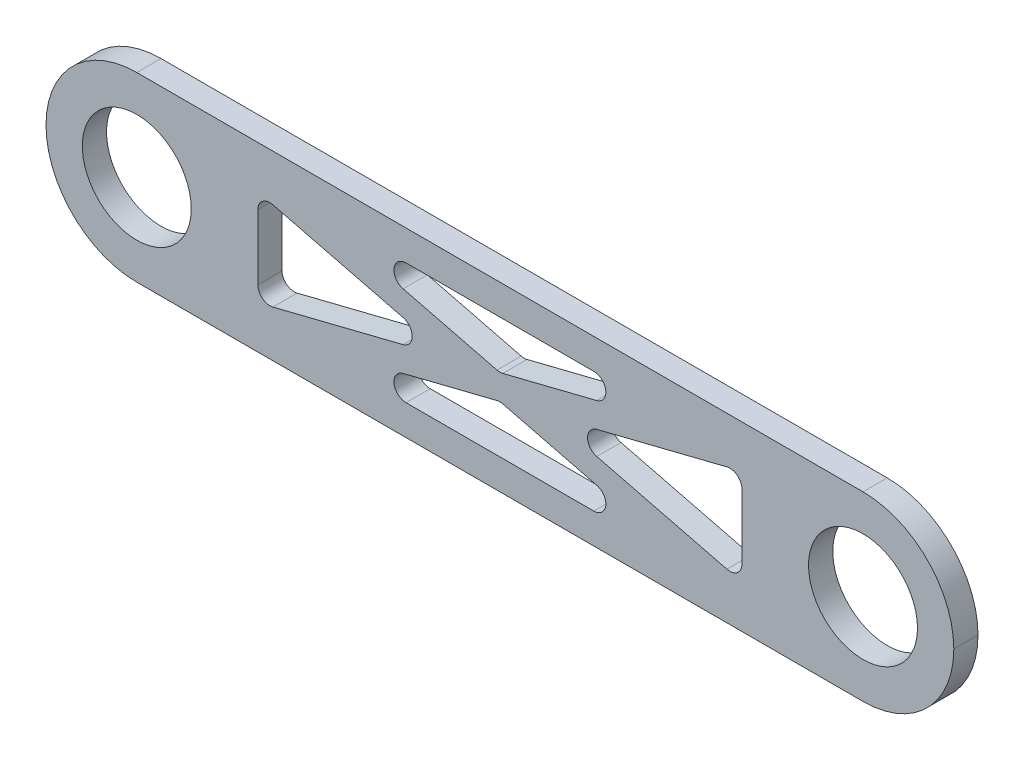
from build123d import *

# Parameters (mm, degrees)
SKETCH_1_W          = 75
SKETCH_1_H          = 15
EXTRUDE_1_DEPTH     = 2
FILLET_1_R          = 7.5
SKETCH_2_R          = 4.5
CUT_EXTRUDE_1_DEPTH = 2
CUT_EXTRUDE_2_DEPTH = 10
FILLET_2_R          = 1


with BuildPart() as part:
    # 草图1 → 凸台-拉伸1 (new body)
    with BuildSketch(Plane.XY):
        Rectangle(SKETCH_1_W, SKETCH_1_H)
    extrude(amount=EXTRUDE_1_DEPTH)

    # 圆角1
    fillet_1_edges = [part.edges().sort_by_distance(p)[0] for p in [
        (37.5, -7.5, 1),
        (-37.5, -7.5, 1),
        (-37.5, 7.5, 1),
        (37.5, 7.5, 1),
    ]]
    fillet(fillet_1_edges, radius=FILLET_1_R - 0.0001)  # a hair under: the kernel refuses the full size

    # 草图2 → 切除-拉伸1 (cut)
    with BuildSketch(Plane.XY.offset(2)):
        with Locations((30, 0)):
            Circle(SKETCH_2_R)
        with Locations((-30, 0)):
            Circle(SKETCH_2_R)
    extrude(amount=-CUT_EXTRUDE_1_DEPTH, mode=Mode.SUBTRACT)

    # 草图3 → 切除-拉伸2 (cut)
    with BuildSketch(Plane.XY.offset(2)):
        Polygon((4.123105626, 0), (20, 3.969223594), (20, -3.969223594), align=None)
        Polygon((-15.876894374, 5), (0, 1.030776406), (15.876894374, 5), align=None)
        Polygon((0, -1.030776406), (15.876894374, -5), (-15.876894374, -5), align=None)
        Polygon((-20, 3.969223594), (-20, -3.969223594), (-4.123105626, 0), align=None)
    extrude(amount=-CUT_EXTRUDE_2_DEPTH, mode=Mode.SUBTRACT)

    # 圆角2
    fillet_2_edges = [part.edges().sort_by_distance(p)[0] for p in [
        (4.123105626, 0, 1),
        (20, 3.969223594, 1),
        (20, -3.969223594, 1),
        (0, -1.030776406, 1),
        (15.876894374, -5, 1),
        (-15.876894374, -5, 1),
        (-20, -3.969223594, 1),
        (-20, 3.969223594, 1),
        (-4.123105626, 0, 1),
        (0, 1.030776406, 1),
        (-15.876894374, 5, 1),
        (15.876894374, 5, 1),
    ]]
    fillet(fillet_2_edges, radius=FILLET_2_R)


solid = part.part
